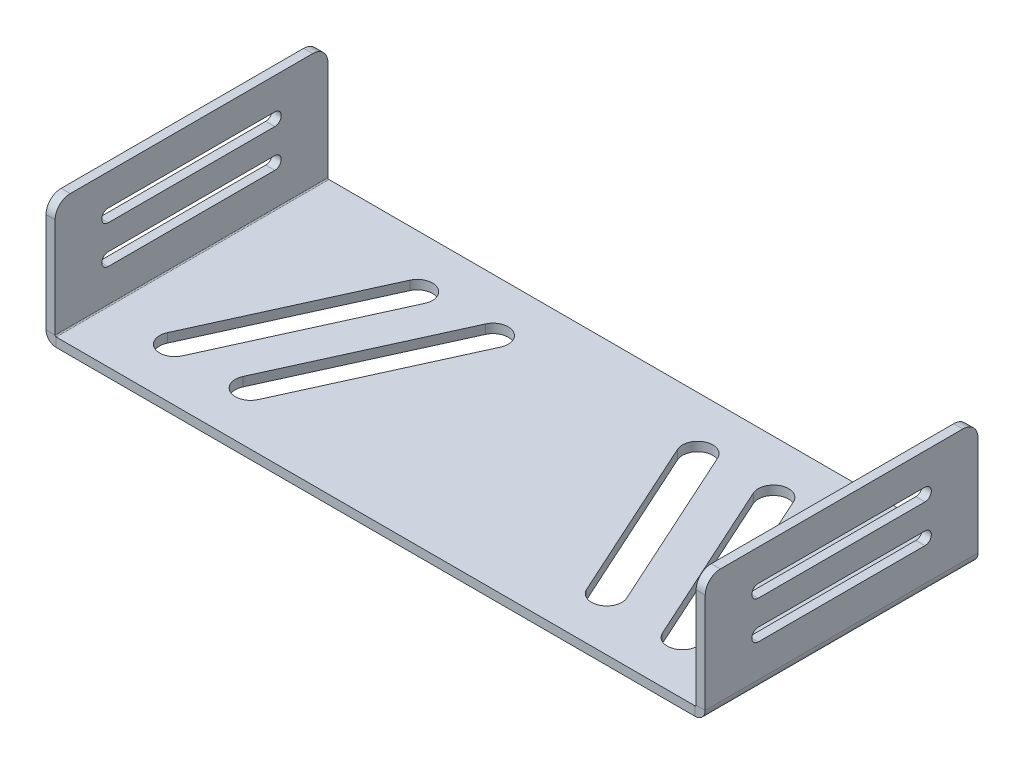
from build123d import *

# Parameters (mm, degrees)
BASE_FLANGE1_DEPTH         = 6
SKETCHED_START             = -292.5
SKETCHED_BEND1_OUTLINE_W   = 6
SKETCHED_BEND1_OUTLINE_H   = 180
SKETCHED_BEND1_DEPTH       = 75
SKETCHED_START_2           = 217.5
SKETCHED_BEND1_2_OUTLINE_W = 6
SKETCHED_BEND1_2_OUTLINE_H = 180
SKETCHED_BEND1_2_DEPTH     = 75
SKETCHED_START_3           = -217.5
SKETCHED_BEND1_3_DEPTH     = 6.7366
SKETCHED_START_4           = 210.7634
SKETCHED_BEND1_4_DEPTH     = 6.7366
SKETCHED_START_5           = -91
SKETCHED_BEND1_5_DEPTH     = 182


with BuildPart() as part:
    # Base-Flange1: sheet metal written as solids
    # Sketch1 → Base-Flange1 (new body)
    with BuildSketch(Plane(origin=(0, 0, 0), x_dir=(1, 0, 0), z_dir=(0, 1, 0))):
        with BuildLine():
            Line((-282.5, 90), (282.5, 90))
            ThreePointArc((282.5, 90), (289.571067812, 87.071067812), (292.5, 80))
            Line((292.5, 80), (292.5, -80))
            ThreePointArc((292.5, -80), (289.571067812, -87.071067812), (282.5, -90))
            Line((282.5, -90), (-282.5, -90))
            ThreePointArc((-282.5, -90), (-289.571067812, -87.071067812), (-292.5, -80))
            Line((-292.5, -80), (-292.5, 80))
            ThreePointArc((-292.5, 80), (-289.571067812, 87.071067812), (-282.5, 90))
        make_face()
        with BuildLine():
            Line((-263.3, 55), (-263.3, -55))
            ThreePointArc((-263.3, -55), (-267.5, -59.2), (-271.7, -55))
            Line((-271.7, -55), (-271.7, 55))
            ThreePointArc((-271.7, 55), (-267.5, 59.2), (-263.3, 55))
        make_face(mode=Mode.SUBTRACT)
        with BuildLine():
            Line((-238.3, 55), (-238.3, -55))
            ThreePointArc((-238.3, -55), (-242.5, -59.2), (-246.7, -55))
            Line((-246.7, -55), (-246.7, 55))
            ThreePointArc((-246.7, 55), (-242.5, 59.2), (-238.3, 55))
        make_face(mode=Mode.SUBTRACT)
        with BuildLine():
            Line((246.7, 55), (246.7, -55))
            ThreePointArc((246.7, -55), (242.5, -59.2), (238.3, -55))
            Line((238.3, -55), (238.3, 55))
            ThreePointArc((238.3, 55), (242.5, 59.2), (246.7, 55))
        make_face(mode=Mode.SUBTRACT)
        with BuildLine():
            Line((271.7, 55), (271.7, -55))
            ThreePointArc((271.7, -55), (267.5, -59.2), (263.3, -55))
            Line((263.3, -55), (263.3, 55))
            ThreePointArc((263.3, 55), (267.5, 59.2), (271.7, 55))
        make_face(mode=Mode.SUBTRACT)
        with BuildLine():
            Line((-108.396335225, 50.861970557), (-158.396335225, -59.138029443))
            ThreePointArc((-158.396335225, -59.138029443), (-171.638029443, -64.103664775), (-176.603664775, -50.861970557))
            Line((-176.603664775, -50.861970557), (-126.603664775, 59.138029443))
            ThreePointArc((-126.603664775, 59.138029443), (-113.361970557, 64.103664775), (-108.396335225, 50.861970557))
        make_face(mode=Mode.SUBTRACT)
        with BuildLine():
            Line((-58.396335225, 50.861970557), (-108.396335225, -59.138029443))
            ThreePointArc((-108.396335225, -59.138029443), (-121.638029443, -64.103664775), (-126.603664775, -50.861970557))
            Line((-126.603664775, -50.861970557), (-76.603664775, 59.138029443))
            ThreePointArc((-76.603664775, 59.138029443), (-63.361970557, 64.103664775), (-58.396335225, 50.861970557))
        make_face(mode=Mode.SUBTRACT)
        with BuildLine():
            Line((76.603664775, 59.138029443), (126.603664775, -50.861970557))
            ThreePointArc((126.603664775, -50.861970557), (121.638029443, -64.103664775), (108.396335225, -59.138029443))
            Line((108.396335225, -59.138029443), (58.396335225, 50.861970557))
            ThreePointArc((58.396335225, 50.861970557), (63.361970557, 64.103664775), (76.603664775, 59.138029443))
        make_face(mode=Mode.SUBTRACT)
        with BuildLine():
            Line((126.603664775, 59.138029443), (176.603664775, -50.861970557))
            ThreePointArc((176.603664775, -50.861970557), (171.638029443, -64.103664775), (158.396335225, -59.138029443))
            Line((158.396335225, -59.138029443), (108.396335225, 50.861970557))
            ThreePointArc((108.396335225, 50.861970557), (113.361970557, 64.103664775), (126.603664775, 59.138029443))
        make_face(mode=Mode.SUBTRACT)
    extrude(amount=-BASE_FLANGE1_DEPTH)

    # Sketched Bend1: read off the stored shape, not the designer's step
    # Sketched Bend1 outline → Sketched Bend1 (cut)
    with BuildSketch(Plane.YZ.offset(SKETCHED_START)):
        with Locations((-3, 0)):
            Rectangle(SKETCHED_BEND1_OUTLINE_W, SKETCHED_BEND1_OUTLINE_H)
    extrude(amount=SKETCHED_BEND1_DEPTH, mode=Mode.SUBTRACT)

    # Sketched Bend1 2 outline → Sketched Bend1 2 (cut)
    with BuildSketch(Plane.YZ.offset(SKETCHED_START_2)):
        with Locations((-3, 0)):
            Rectangle(SKETCHED_BEND1_2_OUTLINE_W, SKETCHED_BEND1_2_OUTLINE_H)
    extrude(amount=SKETCHED_BEND1_2_DEPTH, mode=Mode.SUBTRACT)

    # Sketched Bend1 3 outline → Sketched Bend1 3 (add)
    with BuildSketch(Plane.YZ.offset(SKETCHED_START_3)):
        with BuildLine():
            Line((0, 90), (0, -90))
            Line((0, -90), (66.603762445, -90))
            ThreePointArc((66.603762445, -90), (73.674830257, -87.071067812), (76.603762445, -80))
            Line((76.603762445, -80), (76.603762445, 80))
            ThreePointArc((76.603762445, 80), (73.674830257, 87.071067812), (66.603762445, 90))
            Line((66.603762445, 90), (0, 90))
        make_face()
        with BuildLine():
            ThreePointArc((22.403762445, 55), (26.603762445, 59.2), (30.803762445, 55))
            Line((30.803762445, 55), (30.803762445, -55))
            ThreePointArc((30.803762445, -55), (26.603762445, -59.2), (22.403762445, -55))
            Line((22.403762445, -55), (22.403762445, 55))
        make_face(mode=Mode.SUBTRACT)
        with BuildLine():
            ThreePointArc((47.403762445, 55), (51.603762445, 59.2), (55.803762445, 55))
            Line((55.803762445, 55), (55.803762445, -55))
            ThreePointArc((55.803762445, -55), (51.603762445, -59.2), (47.403762445, -55))
            Line((47.403762445, -55), (47.403762445, 55))
        make_face(mode=Mode.SUBTRACT)
    extrude(amount=SKETCHED_BEND1_3_DEPTH)

    # Sketched Bend1 4 outline → Sketched Bend1 4 (add)
    with BuildSketch(Plane.YZ.offset(SKETCHED_START_4)):
        with BuildLine():
            Line((0, 90), (0, -90))
            Line((0, -90), (66.603762445, -90))
            ThreePointArc((66.603762445, -90), (73.674830257, -87.071067812), (76.603762445, -80))
            Line((76.603762445, -80), (76.603762445, 80))
            ThreePointArc((76.603762445, 80), (73.674830257, 87.071067812), (66.603762445, 90))
            Line((66.603762445, 90), (0, 90))
        make_face()
        with BuildLine():
            ThreePointArc((22.403762445, 55), (26.603762445, 59.2), (30.803762445, 55))
            Line((30.803762445, 55), (30.803762445, -55))
            ThreePointArc((30.803762445, -55), (26.603762445, -59.2), (22.403762445, -55))
            Line((22.403762445, -55), (22.403762445, 55))
        make_face(mode=Mode.SUBTRACT)
        with BuildLine():
            ThreePointArc((47.403762445, 55), (51.603762445, 59.2), (55.803762445, 55))
            Line((55.803762445, 55), (55.803762445, -55))
            ThreePointArc((55.803762445, -55), (51.603762445, -59.2), (47.403762445, -55))
            Line((47.403762445, -55), (47.403762445, 55))
        make_face(mode=Mode.SUBTRACT)
    extrude(amount=SKETCHED_BEND1_4_DEPTH)

    # Sketched Bend1 5 outline → Sketched Bend1 5 (cut)
    with BuildSketch(Plane.XY.offset(SKETCHED_START_5)):
        with BuildLine():
            Line((-217.5, -6), (-210.7634, -6))
            ThreePointArc((-210.7634, -6), (-215.526895542, -4.026895542), (-217.5, 0.7366))
            Line((-217.5, 0.7366), (-217.5, -6))
        make_face()
        with BuildLine():
            ThreePointArc((217.5, 0.7366), (215.526895542, -4.026895542), (210.7634, -6))
            Line((210.7634, -6), (217.5, -6))
            Line((217.5, -6), (217.5, 0.7366))
        make_face()
        with BuildLine():
            Line((-210.7634, 0), (-210.7634, 76.603762445))
            Line((-210.7634, 76.603762445), (-211.5, 76.603762445))
            Line((-211.5, 76.603762445), (-211.5, 0.7366))
            ThreePointArc((-211.5, 0.7366), (-211.284254855, 0.215745145), (-210.7634, 0))
        make_face()
        with BuildLine():
            ThreePointArc((210.7634, 0), (211.284254855, 0.215745145), (211.5, 0.7366))
            Line((211.5, 0.7366), (211.5, 76.603762445))
            Line((211.5, 76.603762445), (210.7634, 76.603762445))
            Line((210.7634, 76.603762445), (210.7634, 0))
        make_face()
    extrude(amount=SKETCHED_BEND1_5_DEPTH, mode=Mode.SUBTRACT)


solid = part.part
